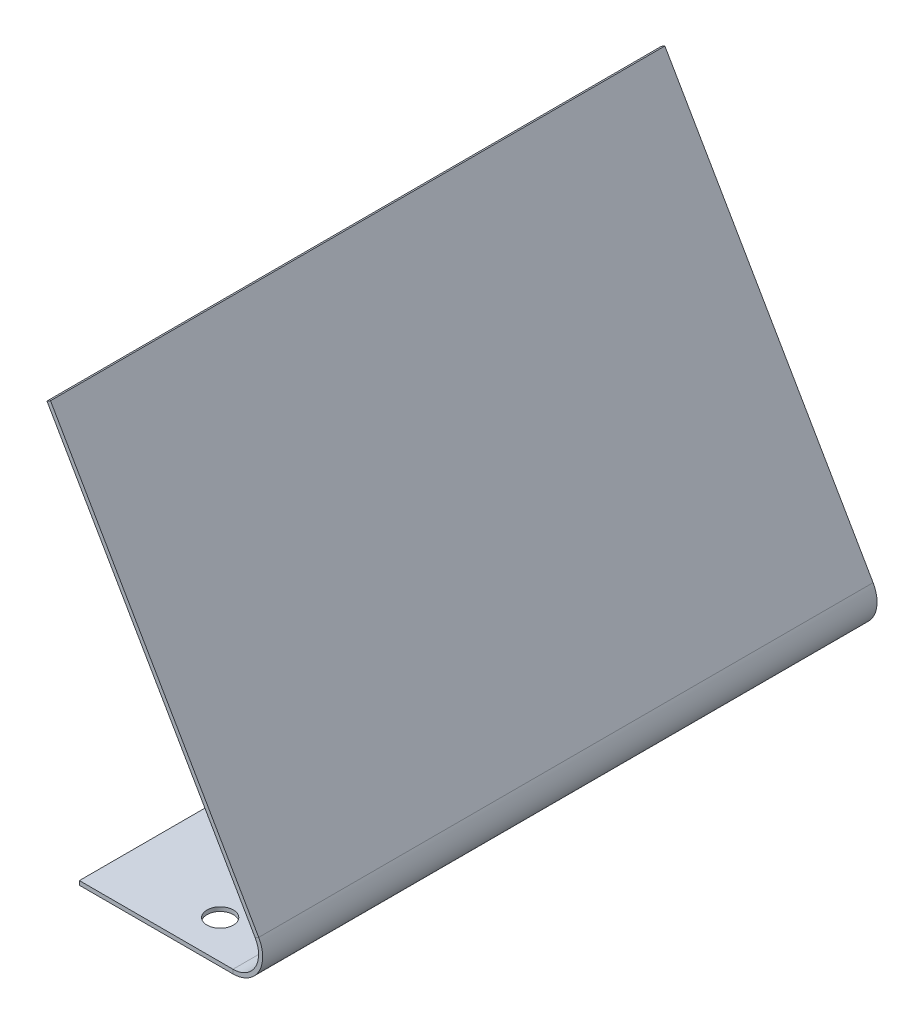
from build123d import *

# Parameters (mm, degrees)
SKETCH2_W                 = 19.05
SKETCH2_H                 = 76.2
BOSS_EXTRUDE2_DEPTH       = 0.508
EDGE_FLANGE2_DEPTH        = 76.2
F_4_CLEARANCE_HOLE1_D     = 3.2639
F_4_CLEARANCE_HOLE1_DEPTH = 0.508


# Sheet-metal steps are written as plain solids
with BuildPart() as part:
    # Sketch2 → Boss-Extrude2 (new body)
    with BuildSketch(Plane(origin=(0, 0, 0), x_dir=(1, 0, 0), z_dir=(0, 1, 0))):
        with Locations((-9.525, 38.1)):
            Rectangle(SKETCH2_W, SKETCH2_H)
    extrude(amount=BOSS_EXTRUDE2_DEPTH)

    # Edge-Flange2 section (across the edge) → Edge-Flange2 (add)
    with BuildSketch(Plane(origin=(5.499261314, 0.508, 0), x_dir=(-0.8660254037844398, -0.499999999999998, 0), z_dir=(0, 0, -1))):
        with BuildLine():
            Line((-0.508, 5.499261314), (-0.508, 57.15))
            Line((-0.508, 57.15), (0, 57.15))
            Line((0, 57.15), (0, 5.499261314))
            ThreePointArc((0, 5.499261314), (1.5875, 2.749630657), (4.7625, 2.749630657))
            Line((4.7625, 2.749630657), (5.0165, 2.309689752))
            ThreePointArc((5.0165, 2.309689752), (1.3335, 2.309689752), (-0.508, 5.499261314))
        make_face()
    extrude(amount=EDGE_FLANGE2_DEPTH)

    # #4 Clearance Hole1
    with Locations(Plane(origin=(0, 0, 0), x_dir=(-1, 0, 0), z_dir=(0, -1, 0))):
        with Locations((6.35, 71.4375), (6.35, 4.7625)):
            Hole(F_4_CLEARANCE_HOLE1_D / 2, depth=F_4_CLEARANCE_HOLE1_DEPTH)


solid = part.part
